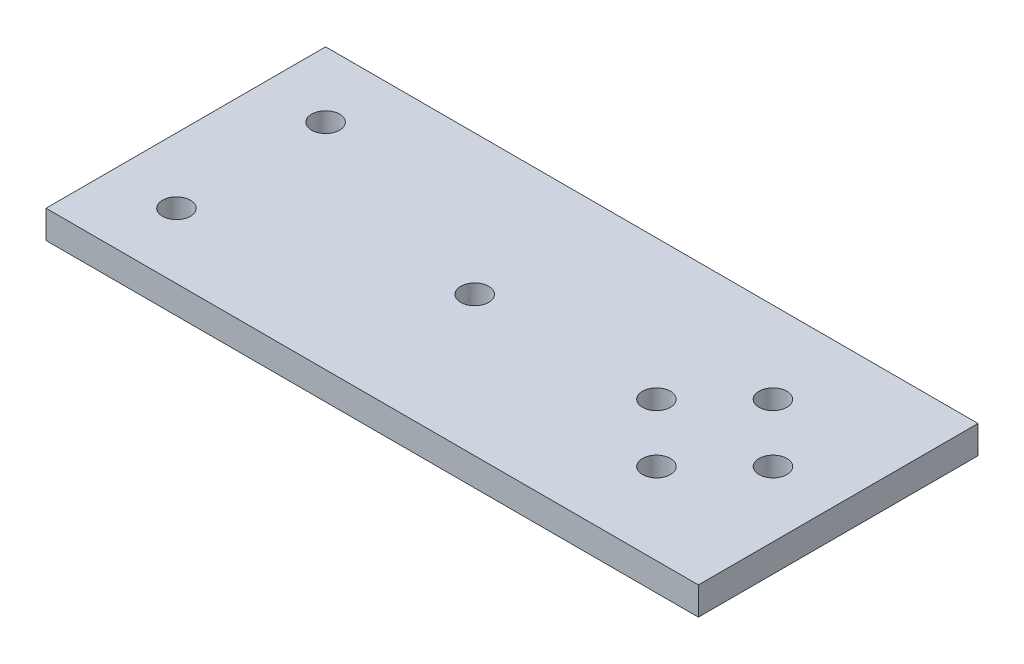
from build123d import *

# Parameters (mm, degrees)
SZKIC1_W                   = 70
SZKIC1_H                   = 30
ODGI_CIE_BAZOWE1_DEPTH     = 3
WYTNIJ_WYCI_GNI_CIE1_REACH = 40.197
SZKIC6_R                   = 1.5
WYTNIJ_WYCI_GNI_CIE2_REACH = 40.197
SZKIC7_R                   = 1.5
WYTNIJ_WYCI_GNI_CIE3_REACH = 40.197
SZKIC10_R                  = 1.5


# Sheet-metal steps are written as plain solids
with BuildPart() as part:
    # Szkic1 → Odgięcie bazowe1 (new body)
    with BuildSketch(Plane(origin=(0, 0, 0), x_dir=(1, 0, 0), z_dir=(0, 1, 0))):
        Rectangle(SZKIC1_W, SZKIC1_H)
    extrude(amount=-ODGI_CIE_BAZOWE1_DEPTH)

    # Szkic6 → Wytnij-wyciągnięcie1 (cut, up to next)
    with BuildSketch(Plane(origin=(0, 0, 0), x_dir=(1, 0, 0), z_dir=(0, 1, 0)), mode=Mode.PRIVATE) as wytnij_wyci_gni_cie1_sk1:
        with Locations(Location((-28, 8, 0), (0, 0, 270))):
            Circle(SZKIC6_R)
    wytnij_wyci_gni_cie1_tool1 = extrude(wytnij_wyci_gni_cie1_sk1.sketch, amount=-WYTNIJ_WYCI_GNI_CIE1_REACH, mode=Mode.PRIVATE) & part.part
    wytnij_wyci_gni_cie1 = wytnij_wyci_gni_cie1_tool1.solids().sort_by_distance((-28, 0, -8))[0]
    add(wytnij_wyci_gni_cie1, mode=Mode.SUBTRACT)

    # Lustro1: Wytnij-wyciągnięcie1 across plane
    add(wytnij_wyci_gni_cie1.mirror(Plane.XY), mode=Mode.SUBTRACT)

    # Szkic7 → Wytnij-wyciągnięcie2 (cut, up to next)
    with BuildSketch(Plane(origin=(0, 0, 0), x_dir=(1, 0, 0), z_dir=(0, 1, 0)), mode=Mode.PRIVATE) as wytnij_wyci_gni_cie2_sk1:
        with Locations(Location((28, 0, 0), (0, 0, 270))):
            Circle(SZKIC7_R)
    wytnij_wyci_gni_cie2_tool1 = extrude(wytnij_wyci_gni_cie2_sk1.sketch, amount=-WYTNIJ_WYCI_GNI_CIE2_REACH, mode=Mode.PRIVATE) & part.part
    wytnij_wyci_gni_cie2 = wytnij_wyci_gni_cie2_tool1.solids().sort_by_distance((28, 0, 0))[0]
    add(wytnij_wyci_gni_cie2, mode=Mode.SUBTRACT)

    # Szkic-szyk1: Wytnij-wyciągnięcie2 at 3 more places
    with Locations((-12.5, 0, 0), (-6.25, 0, -6.25), (-6.25, 0, 6.25)):
        add(wytnij_wyci_gni_cie2, mode=Mode.SUBTRACT)

    # Szkic10 → Wytnij-wyciągnięcie3 (cut, up to next)
    with BuildSketch(Plane(origin=(0, 0, 0), x_dir=(1, 0, 0), z_dir=(0, 1, 0)), mode=Mode.PRIVATE) as wytnij_wyci_gni_cie3_sk1:
        with Locations(Location((-4, 0, 0), (0, 0, 270))):
            Circle(SZKIC10_R)
    wytnij_wyci_gni_cie3_tool1 = extrude(wytnij_wyci_gni_cie3_sk1.sketch, amount=-WYTNIJ_WYCI_GNI_CIE3_REACH, mode=Mode.PRIVATE) & part.part
    add(wytnij_wyci_gni_cie3_tool1.solids().sort_by_distance((-4, 0, 0))[0], mode=Mode.SUBTRACT)


solid = part.part
